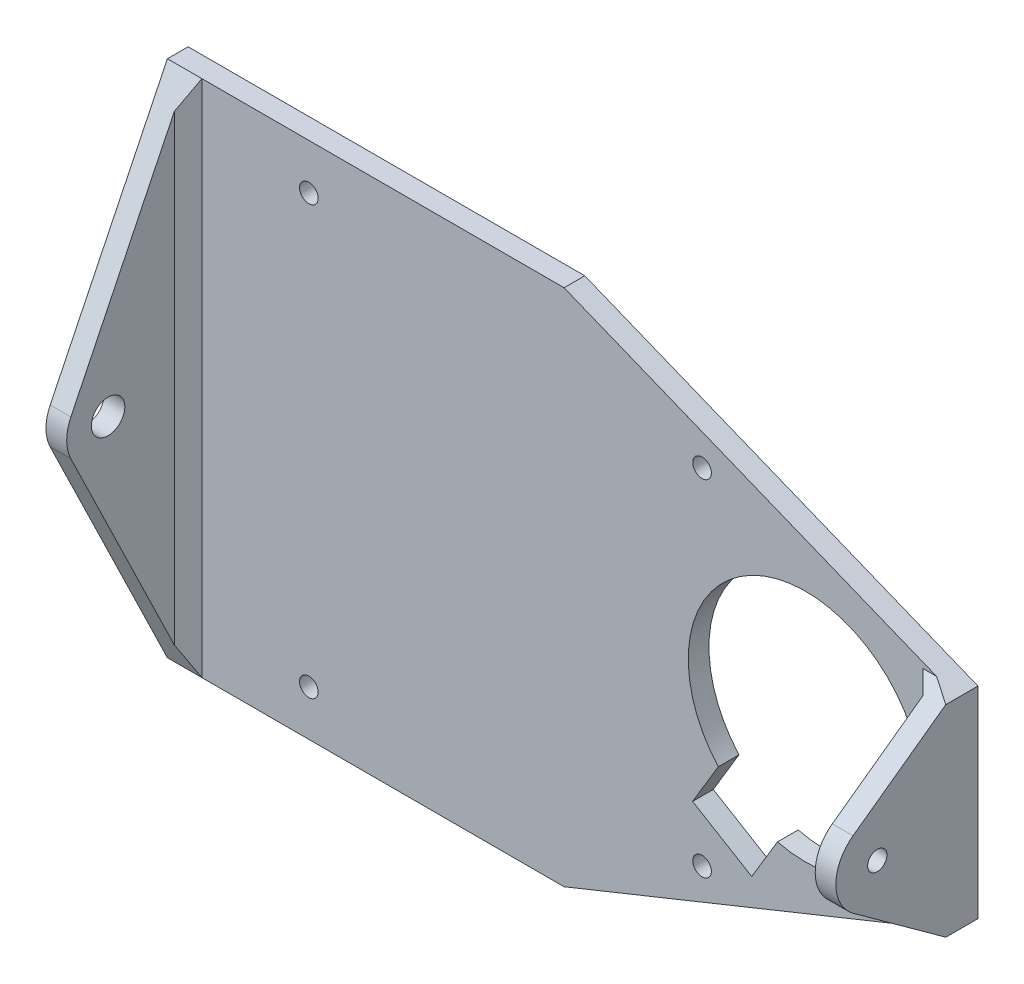
from build123d import *

# Parameters (mm, degrees)
SKETCH1_W           = 114.5
SKETCH1_H           = 75.2
BOSS_EXTRUDE1_DEPTH = 3
CUT_EXTRUDE1_REACH  = 83.282
SKETCH3_R           = 1.35
SKETCH5_W           = 3
SKETCH5_H           = 75.2
BOSS_EXTRUDE3_DEPTH = 17.6
CUT_EXTRUDE2_REACH  = 124.264
CUT_EXTRUDE3_REACH  = 124.264
CUT_EXTRUDE4_REACH  = 121.459
CUT_EXTRUDE5_REACH  = 121.459
CUT_EXTRUDE6_REACH  = 124.264
SKETCH10_R          = 2.425
CUT_EXTRUDE7_REACH  = 124.264
SKETCH11_R          = 1.4
CHAMFER1_SIZE       = 2


with BuildPart() as part:
    # Sketch1 → Boss-Extrude1 (new body)
    with BuildSketch(Plane.XY):
        with Locations((14.75, 0)):
            Rectangle(SKETCH1_W, SKETCH1_H)
    extrude(amount=BOSS_EXTRUDE1_DEPTH)

    # Sketch3 → Cut-Extrude1 (cut, up to next)
    with BuildSketch(Plane.XY, mode=Mode.PRIVATE) as cut_extrude1_sk1:
        with Locations(Location((35, 25, 0), (0, 0, 180))):
            Circle(SKETCH3_R)
    cut_extrude1_tool1 = extrude(cut_extrude1_sk1.sketch, amount=CUT_EXTRUDE1_REACH, mode=Mode.PRIVATE) & part.part
    # Sketch3 → Cut-Extrude1 (cut, up to next)
    with BuildSketch(Plane.XY, mode=Mode.PRIVATE) as cut_extrude1_sk2:
        with Locations(Location((-22, 31, 0), (0, 0, 180))):
            Circle(SKETCH3_R)
    cut_extrude1_tool2 = extrude(cut_extrude1_sk2.sketch, amount=CUT_EXTRUDE1_REACH, mode=Mode.PRIVATE) & part.part
    # Sketch3 → Cut-Extrude1 (cut, up to next)
    with BuildSketch(Plane.XY, mode=Mode.PRIVATE) as cut_extrude1_sk3:
        with Locations(Location((-22, -31, 0), (0, 0, 180))):
            Circle(SKETCH3_R)
    cut_extrude1_tool3 = extrude(cut_extrude1_sk3.sketch, amount=CUT_EXTRUDE1_REACH, mode=Mode.PRIVATE) & part.part
    # Sketch3 → Cut-Extrude1 (cut, up to next)
    with BuildSketch(Plane.XY, mode=Mode.PRIVATE) as cut_extrude1_sk4:
        with Locations(Location((35, -25, 0), (0, 0, 180))):
            Circle(SKETCH3_R)
    cut_extrude1_tool4 = extrude(cut_extrude1_sk4.sketch, amount=CUT_EXTRUDE1_REACH, mode=Mode.PRIVATE) & part.part
    # Sketch3 → Cut-Extrude1 (cut, up to next)
    with BuildSketch(Plane.XY, mode=Mode.PRIVATE) as cut_extrude1_sk5:
        with BuildLine():
            Line((37.352968819, -11.360132143), (33.626035358, -17.571687912))
            Line((33.626035358, -17.571687912), (42.200964615, -22.716645466))
            Line((42.200964615, -22.716645466), (45.927898076, -16.505089698))
            ThreePointArc((45.927898076, -16.505089698), (58.746427842, 14.577379737), (37.352968819, -11.360132143))
        make_face()
    cut_extrude1_tool5 = extrude(cut_extrude1_sk5.sketch, amount=CUT_EXTRUDE1_REACH, mode=Mode.PRIVATE) & part.part
    # Sketch3 → Cut-Extrude1 (cut, up to next)
    with BuildSketch(Plane.XY, mode=Mode.PRIVATE) as cut_extrude1_sk6:
        Polygon((15, -37.6), (72, -14.6), (72, -37.6), align=None)
    cut_extrude1_tool6 = extrude(cut_extrude1_sk6.sketch, amount=CUT_EXTRUDE1_REACH, mode=Mode.PRIVATE) & part.part
    # Sketch3 → Cut-Extrude1 (cut, up to next)
    with BuildSketch(Plane.XY, mode=Mode.PRIVATE) as cut_extrude1_sk7:
        Polygon((15, 37.6), (72, 14.6), (72, 37.6), align=None)
    cut_extrude1_tool7 = extrude(cut_extrude1_sk7.sketch, amount=CUT_EXTRUDE1_REACH, mode=Mode.PRIVATE) & part.part
    add(cut_extrude1_tool1.solids().sort_by_distance((35, 25, 0))[0], mode=Mode.SUBTRACT)
    add(cut_extrude1_tool2.solids().sort_by_distance((-22, 31, 0))[0], mode=Mode.SUBTRACT)
    add(cut_extrude1_tool3.solids().sort_by_distance((-22, -31, 0))[0], mode=Mode.SUBTRACT)
    add(cut_extrude1_tool4.solids().sort_by_distance((35, -25, 0))[0], mode=Mode.SUBTRACT)
    add(cut_extrude1_tool5.solids().sort_by_distance((49.284681, -1.192198, 0))[0], mode=Mode.SUBTRACT)
    add(cut_extrude1_tool6.solids().sort_by_distance((53, -29.933333, 0))[0], mode=Mode.SUBTRACT)
    add(cut_extrude1_tool7.solids().sort_by_distance((53, 29.933333, 0))[0], mode=Mode.SUBTRACT)

    # Sketch5 → Boss-Extrude3 (add)
    with BuildSketch(Plane.XY.offset(3)):
        Polygon((72, -14.6), (69, -15.810526316), (69, 15.810526316), (72, 14.6), align=None)
        with Locations((-41, 0)):
            Rectangle(SKETCH5_W, SKETCH5_H)
    extrude(amount=BOSS_EXTRUDE3_DEPTH)

    # Sketch6 → Cut-Extrude2 (cut, up to next)
    with BuildSketch(Plane.ZY.offset(42.5), mode=Mode.PRIVATE) as cut_extrude2_sk1:
        with BuildLine():
            Line((3, 37.6), (19.996596859, 2.62235435))
            ThreePointArc((19.996596859, 2.62235435), (20.447203655, 1.345440234), (20.6, 0))
            Line((20.6, 0), (20.6, 37.6))
            Line((20.6, 37.6), (3, 37.6))
        make_face()
    cut_extrude2_tool1 = extrude(cut_extrude2_sk1.sketch, amount=-CUT_EXTRUDE2_REACH, mode=Mode.PRIVATE) & part.part
    add(cut_extrude2_tool1.solids().sort_by_distance((-42.5, 25.516122, 14.735887))[0], mode=Mode.SUBTRACT)

    # Sketch7 → Cut-Extrude3 (cut, up to next)
    with BuildSketch(Plane.ZY.offset(42.5), mode=Mode.PRIVATE) as cut_extrude3_sk1:
        with BuildLine():
            Line((20.6, 0), (20.6, -37.6))
            Line((20.6, -37.6), (3, -37.6))
            Line((3, -37.6), (19.996596859, -2.62235435))
            ThreePointArc((19.996596859, -2.62235435), (20.447203655, -1.345440234), (20.6, 0))
        make_face()
    cut_extrude3_tool1 = extrude(cut_extrude3_sk1.sketch, amount=-CUT_EXTRUDE3_REACH, mode=Mode.PRIVATE) & part.part
    add(cut_extrude3_tool1.solids().sort_by_distance((-42.5, -25.516122, 14.735887))[0], mode=Mode.SUBTRACT)

    # Sketch8 → Cut-Extrude4 (cut, up to next)
    with BuildSketch(Plane.ZY.offset(-69), mode=Mode.PRIVATE) as cut_extrude4_sk1:
        with BuildLine():
            Line((18.119604827, 4.859257336), (3, 15.810526316))
            Line((3, 15.810526316), (20.6, 15.810526316))
            Line((20.6, 15.810526316), (20.6, 0))
            ThreePointArc((20.6, 0), (19.944044768, 2.727853647), (18.119604827, 4.859257336))
        make_face()
    cut_extrude4_tool1 = extrude(cut_extrude4_sk1.sketch, amount=-CUT_EXTRUDE4_REACH, mode=Mode.PRIVATE) & part.part
    add(cut_extrude4_tool1.solids().sort_by_distance((69, 11.454378, 14.798599))[0], mode=Mode.SUBTRACT)

    # Sketch9 → Cut-Extrude5 (cut, up to next)
    with BuildSketch(Plane.ZY.offset(-69), mode=Mode.PRIVATE) as cut_extrude5_sk1:
        with BuildLine():
            Line((18.119604827, -4.859257336), (3, -15.810526316))
            Line((3, -15.810526316), (20.6, -15.810526316))
            Line((20.6, -15.810526316), (20.6, 0))
            ThreePointArc((20.6, 0), (19.944044768, -2.727853647), (18.119604827, -4.859257336))
        make_face()
    cut_extrude5_tool1 = extrude(cut_extrude5_sk1.sketch, amount=-CUT_EXTRUDE5_REACH, mode=Mode.PRIVATE) & part.part
    add(cut_extrude5_tool1.solids().sort_by_distance((69, -11.454378, 14.798599))[0], mode=Mode.SUBTRACT)

    # Sketch10 → Cut-Extrude6 (cut, up to next)
    with BuildSketch(Plane.ZY.offset(42.5), mode=Mode.PRIVATE) as cut_extrude6_sk1:
        with Locations(Location((14.6, 0, 0), (0, 0, 270))):
            Circle(SKETCH10_R)
    cut_extrude6_tool1 = extrude(cut_extrude6_sk1.sketch, amount=-CUT_EXTRUDE6_REACH, mode=Mode.PRIVATE) & part.part
    add(cut_extrude6_tool1.solids().sort_by_distance((-42.5, 0, 14.6))[0], mode=Mode.SUBTRACT)

    # Sketch11 → Cut-Extrude7 (cut, up to next)
    with BuildSketch(Plane(origin=(72, 0, 0), x_dir=(0, 0, -1), z_dir=(1, 0, 0)), mode=Mode.PRIVATE) as cut_extrude7_sk1:
        with Locations((-14.6, 0)):
            Circle(SKETCH11_R)
    cut_extrude7_tool1 = extrude(cut_extrude7_sk1.sketch, amount=-CUT_EXTRUDE7_REACH, mode=Mode.PRIVATE) & part.part
    add(cut_extrude7_tool1.solids().sort_by_distance((72, 0, 14.6))[0], mode=Mode.SUBTRACT)

    # Chamfer1
    # the kernel refuses this chamfer: 2 mm, written as the material it adds along each edge
    with BuildSketch(Plane(origin=(69, -20.953892292, 3), x_dir=(-0.9996219169112968, 0, -0.0274958766105862), z_dir=(0, 1, 0))) as chamfer1_piece_1_section:
        Polygon((CHAMFER1_SIZE * 0.999621916911, CHAMFER1_SIZE * 0.0274958766106), (-CHAMFER1_SIZE * 0.0274958766106, CHAMFER1_SIZE * 0.999621916911), (0, 0), align=None)
    chamfer1_piece_1 = extrude(amount=41.907784583, mode=Mode.PRIVATE)
    chamfer1_piece_1 = chamfer1_piece_1 - Plane(origin=(50, 0, 3.647655416), x_dir=(-0.23953540727459496, -0.9708876292660207, 0), z_dir=(0, 0, -1)) * Cylinder(17, 92, mode=Mode.PRIVATE)
    chamfer1_piece_1 = split(chamfer1_piece_1, bisect_by=Plane(origin=(68.334125846, -10.062431967, 10.935967533), z_dir=(0, 0.8098762227411254, -0.5866008044987383)), keep=Keep.TOP, mode=Mode.PRIVATE)
    chamfer1_piece_1 = split(chamfer1_piece_1, bisect_by=Plane(origin=(68.334125846, 10.062431967, 10.935967533), z_dir=(0, -0.8098762227411249, -0.5866008044987391)), keep=Keep.TOP, mode=Mode.PRIVATE)
    add(chamfer1_piece_1)
    with BuildSketch(Plane(origin=(-39.5, -37.6, 3), x_dir=(0.9996219169112968, 0, -0.027495876610586296), z_dir=(0, 1, 0))) as chamfer1_piece_2_section:
        Polygon((CHAMFER1_SIZE * 0.999621916911, -CHAMFER1_SIZE * 0.0274958766106), (-CHAMFER1_SIZE * 0.0274958766106, -CHAMFER1_SIZE * 0.999621916911), (0, 0), align=None)
    chamfer1_piece_2 = extrude(amount=75.2, mode=Mode.PRIVATE)
    chamfer1_piece_2 = split(chamfer1_piece_2, bisect_by=Plane(origin=(-38.832756729, 6.928738124, 17.904006933), z_dir=(0, -0.4370590583687447, -0.8994328098851111)), keep=Keep.TOP, mode=Mode.PRIVATE)
    chamfer1_piece_2 = split(chamfer1_piece_2, bisect_by=Plane(origin=(-38.832756729, -6.928738124, 17.904006933), z_dir=(0, 0.4370590583688008, -0.8994328098850838)), keep=Keep.TOP, mode=Mode.PRIVATE)
    add(chamfer1_piece_2)


solid = part.part
